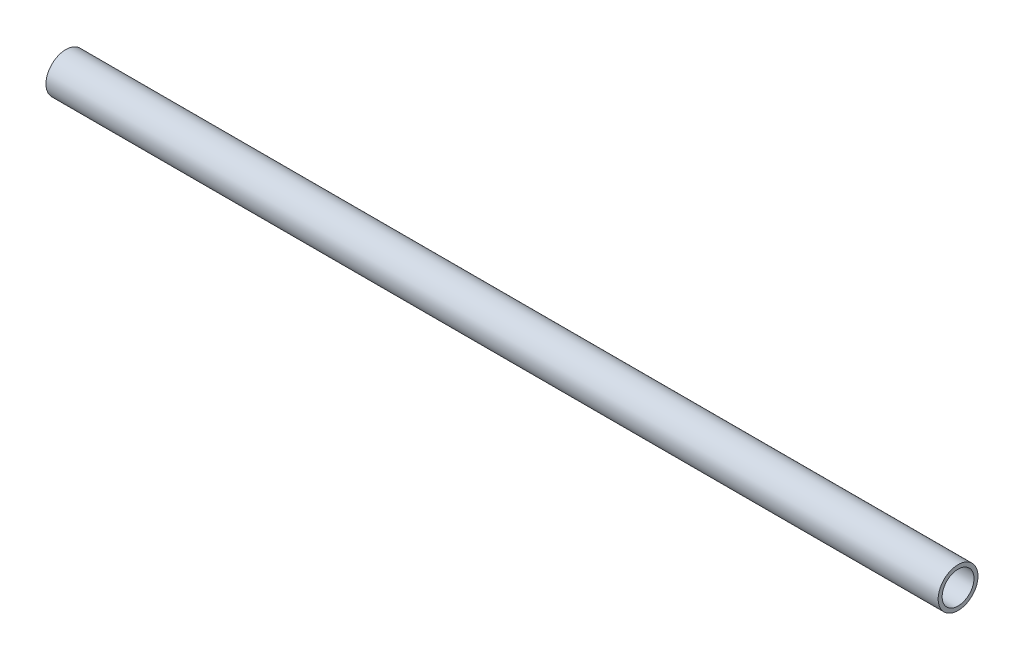
from build123d import *

# Parameters (mm, degrees)
SKETCH1_R      = 15.875
SKETCH1_R_2    = 12.7
EXTRUDE1_DEPTH = 355.6


with BuildPart() as part:
    # Sketch1 → Extrude1 (new, symmetric)
    with BuildSketch(Plane(origin=(0, 0, 0), x_dir=(0, 0, -1), z_dir=(1, 0, 0))):
        Circle(SKETCH1_R)
        Circle(SKETCH1_R_2, mode=Mode.SUBTRACT)
    extrude(amount=EXTRUDE1_DEPTH, both=True)


solid = part.part
